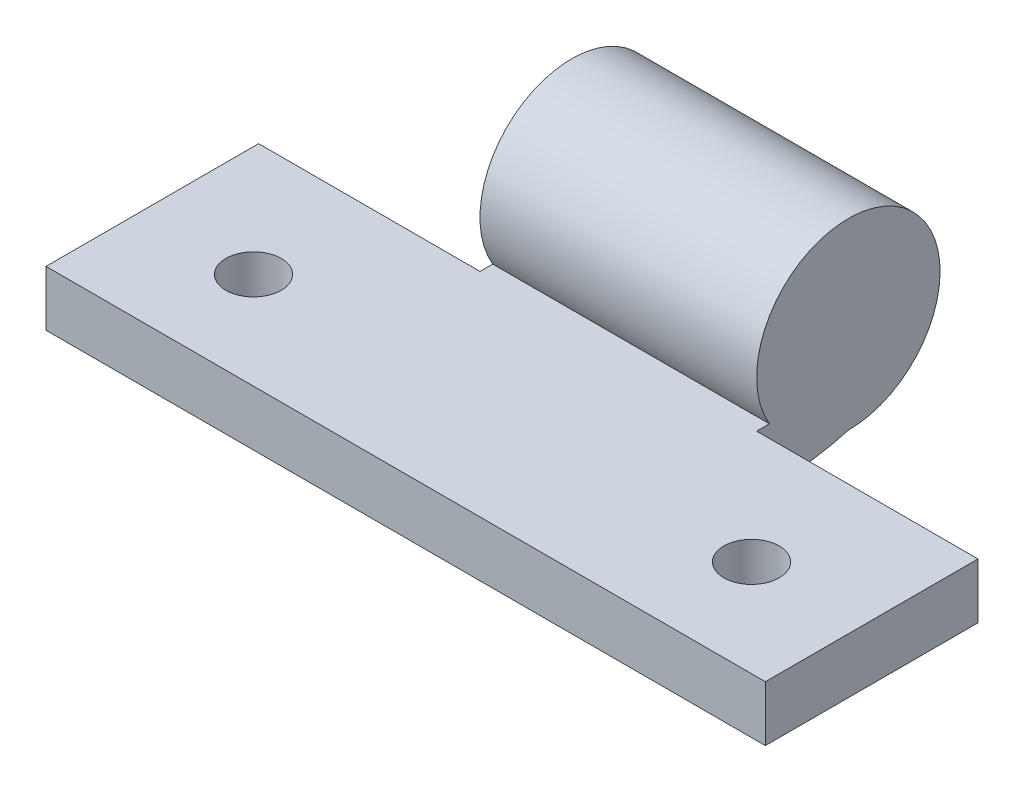
from build123d import *

# Parameters (mm, degrees)
SKETCH_1_W               = 26
SKETCH_1_H               = 11
SKETCH_1_R               = 1
EXTRUDE_1_DEPTH          = 2
SKETCH_2_R               = 3.315
EXTRUDE_2_DEPTH          = 26
FILLET_1_R               = 10
CUT_EXTRUDE_1_DEPTH      = 18.748239349
CUT_EXTRUDE_1_DEPTH_BACK = 18.748239349
SKETCH_3_W               = 8
SKETCH_3_H               = 6.63


with BuildPart() as part:
    # 草图1 → 凸台-拉伸1 (new body)
    with BuildSketch(Plane(origin=(0, 0, 0), x_dir=(1, 0, 0), z_dir=(0, 1, 0))):
        with Locations((0, -5.5)):
            Rectangle(SKETCH_1_W, SKETCH_1_H)
        with Locations(Location((9, -7.5, 0), (0, 0, 270))):
            Circle(SKETCH_1_R, mode=Mode.SUBTRACT)
        with Locations(Location((-9, -7.5, 0), (0, 0, 90))):
            Circle(SKETCH_1_R, mode=Mode.SUBTRACT)
    extrude(amount=EXTRUDE_1_DEPTH)

    # 草图2 → 凸台-拉伸2 (add)
    with BuildSketch(Plane(origin=(13, 0, 0), x_dir=(0, 0, -1), z_dir=(1, 0, 0))):
        with Locations((0, 3.685)):
            Circle(SKETCH_2_R)
    extrude(amount=-EXTRUDE_2_DEPTH)

    # 圆角1
    # the kernel refuses this fillet: 10 mm, written as the material it takes off along each edge
    with BuildSketch(Plane(origin=(19.737534787, 0, 0), x_dir=(0, 1, 0), z_dir=(-1, 0, 0))) as fillet_1_piece_1:
        with BuildLine():
            CenterArc((10, -2.695013915), FILLET_1_R, 164.365401099, 15.634598901)
            Line((0, -2.695013915), (-0.2, -2.695013915))
            Line((-0.2, -2.695013915), (-0.2, 0))
            Line((-0.2, 0), (0, 0.2))
            ThreePointArc((0, 0.2), (0.185, 0.2), (0.1774, 0.053900278))
            Line((0.1774, 0.053900278), (0.37, 0))
        make_face()
    extrude(amount=39.475069573, mode=Mode.SUBTRACT)

    # 草图3 → 切除-拉伸1 (cut, two sides: drawn at the far end of the back side and taken through both)
    with BuildSketch(Plane(origin=(0, 2, 0), x_dir=(1, 0, 0), z_dir=(0, 1, 0)).offset(-CUT_EXTRUDE_1_DEPTH_BACK)):
        with Locations((9, 0)):
            Rectangle(SKETCH_3_W, SKETCH_3_H)
        with Locations((-9, 0)):
            Rectangle(SKETCH_3_W, SKETCH_3_H)
    extrude(amount=CUT_EXTRUDE_1_DEPTH + CUT_EXTRUDE_1_DEPTH_BACK, mode=Mode.SUBTRACT)


solid = part.part
